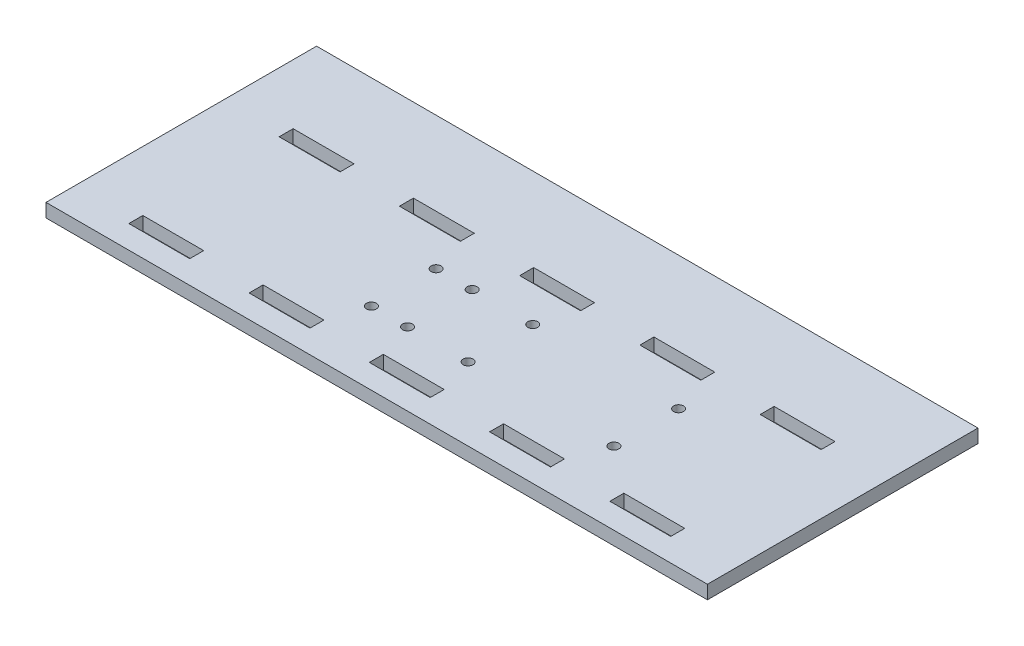
from build123d import *

# Parameters (mm, degrees)
SKETCH2_W           = 220
SKETCH2_H           = 90
BOSS_EXTRUDE1_DEPTH = 4.5
SKETCH3_W           = 20.25
SKETCH3_H           = 4.65
CUT_EXTRUDE1_DEPTH  = 119.933805119
SKETCH5_R           = 1.65
BRACKET_HOLES_DEPTH = 119.933805119


with BuildPart() as part:
    # Sketch2 → Boss-Extrude1 (new body)
    with BuildSketch(Plane(origin=(0, 0, 0), x_dir=(1, 0, 0), z_dir=(0, 1, 0))):
        Rectangle(SKETCH2_W, SKETCH2_H)
    extrude(amount=BOSS_EXTRUDE1_DEPTH)

    # Sketch3 → Cut-Extrude1 (cut, through all)
    with BuildSketch(Plane.XZ):
        with Locations((40, -15)):
            Rectangle(SKETCH3_W, SKETCH3_H)
        with Locations((0, -15)):
            Rectangle(SKETCH3_W, SKETCH3_H)
        with Locations((80, -15)):
            Rectangle(SKETCH3_W, SKETCH3_H)
        with Locations((-80, -15)):
            Rectangle(SKETCH3_W, SKETCH3_H)
        with Locations((-40, -15)):
            Rectangle(SKETCH3_W, SKETCH3_H)
        with Locations((-40, 35)):
            Rectangle(SKETCH3_W, SKETCH3_H)
        with Locations((-80, 35)):
            Rectangle(SKETCH3_W, SKETCH3_H)
        with Locations((80, 35)):
            Rectangle(SKETCH3_W, SKETCH3_H)
        with Locations((40, 35)):
            Rectangle(SKETCH3_W, SKETCH3_H)
        with Locations((0, 35)):
            Rectangle(SKETCH3_W, SKETCH3_H)
    extrude(amount=-CUT_EXTRUDE1_DEPTH, mode=Mode.SUBTRACT)

    # Sketch5 → Bracket holes (cut, through all)
    with BuildSketch(Plane.XZ):
        with Locations((-26, 20.75)):
            Circle(SKETCH5_R)
        with Locations((-14, 20.75)):
            Circle(SKETCH5_R)
        with Locations((6.15, 20.75)):
            Circle(SKETCH5_R)
        with Locations((54.65, 20.75)):
            Circle(SKETCH5_R)
        with Locations((54.65, -0.75)):
            Circle(SKETCH5_R)
        with Locations((6.15, -0.75)):
            Circle(SKETCH5_R)
        with Locations((-14, -0.75)):
            Circle(SKETCH5_R)
        with Locations((-26, -0.75)):
            Circle(SKETCH5_R)
    extrude(amount=-BRACKET_HOLES_DEPTH, mode=Mode.SUBTRACT)


solid = part.part
